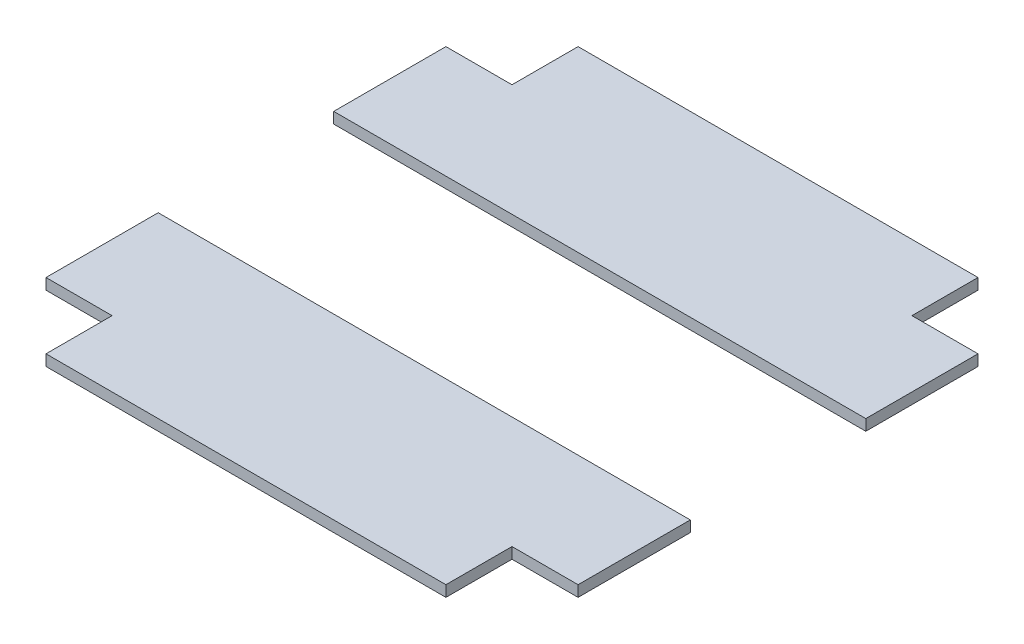
from build123d import *

# Parameters (mm, degrees)
SKETCH1_W           = 4908.55
SKETCH1_H           = 4908.55
BOSS_EXTRUDE1_DEPTH = 101.6
SKETCH2_W           = 4908.55
SKETCH2_H           = 1619.25
CUT_EXTRUDE1_DEPTH  = 3473.355700566
SKETCH3_W           = 609.6
SKETCH3_H           = 609.6
CUT_EXTRUDE2_DEPTH  = 3473.355700566


with BuildPart() as part:
    # Sketch1 → Boss-Extrude1 (new body)
    with BuildSketch(Plane(origin=(0, 0, 0), x_dir=(1, 0, 0), z_dir=(0, 1, 0))):
        Rectangle(SKETCH1_W, SKETCH1_H)
    extrude(amount=BOSS_EXTRUDE1_DEPTH)

    # Sketch2 → Cut-Extrude1 (cut, through all)
    with BuildSketch(Plane(origin=(0, 101.6, 0), x_dir=(1, 0, 0), z_dir=(0, 1, 0))):
        Rectangle(SKETCH2_W, SKETCH2_H)
    extrude(amount=-CUT_EXTRUDE1_DEPTH, mode=Mode.SUBTRACT)


with BuildPart() as cut_extrude1_piece_1:
    # of the separate pieces the step leaves, piece 1, a body of its own (cut_extrude1_pieces)
    add(part.part.solids().sort_by_distance((-2454.275, 0, -2454.275))[0])


with BuildPart() as cut_extrude1_piece_2:
    # of the separate pieces the step leaves, piece 2, a body of its own (cut_extrude1_pieces)
    add(part.part.solids().sort_by_distance((-2454.275, 0, 2454.275))[0])


with BuildPart() as cut_extrude2_tool:
    # Sketch3 → Cut-Extrude2 (new, through all)
    with BuildSketch(Plane(origin=(0, 101.6, 0), x_dir=(1, 0, 0), z_dir=(0, 1, 0))):
        with Locations((-2149.475, -2149.475)):
            Rectangle(SKETCH3_W, SKETCH3_H)
        with Locations((2149.475, -2149.475)):
            Rectangle(SKETCH3_W, SKETCH3_H)
        with Locations((-2149.475, 2149.475)):
            Rectangle(SKETCH3_W, SKETCH3_H)
        with Locations((2149.475, 2149.475)):
            Rectangle(SKETCH3_W, SKETCH3_H)
    extrude(amount=-CUT_EXTRUDE2_DEPTH)


with BuildPart() as cut_extrude1_piece_1_1:
    add(cut_extrude1_piece_1.part)

    # Cut-Extrude2: cut by cut_extrude2_tool
    add(cut_extrude2_tool.part, mode=Mode.SUBTRACT)


with BuildPart() as cut_extrude1_piece_2_1:
    add(cut_extrude1_piece_2.part)

    # Cut-Extrude2: cut by cut_extrude2_tool
    add(cut_extrude2_tool.part, mode=Mode.SUBTRACT)


solid = Compound([cut_extrude1_piece_1_1.part, cut_extrude1_piece_2_1.part])
